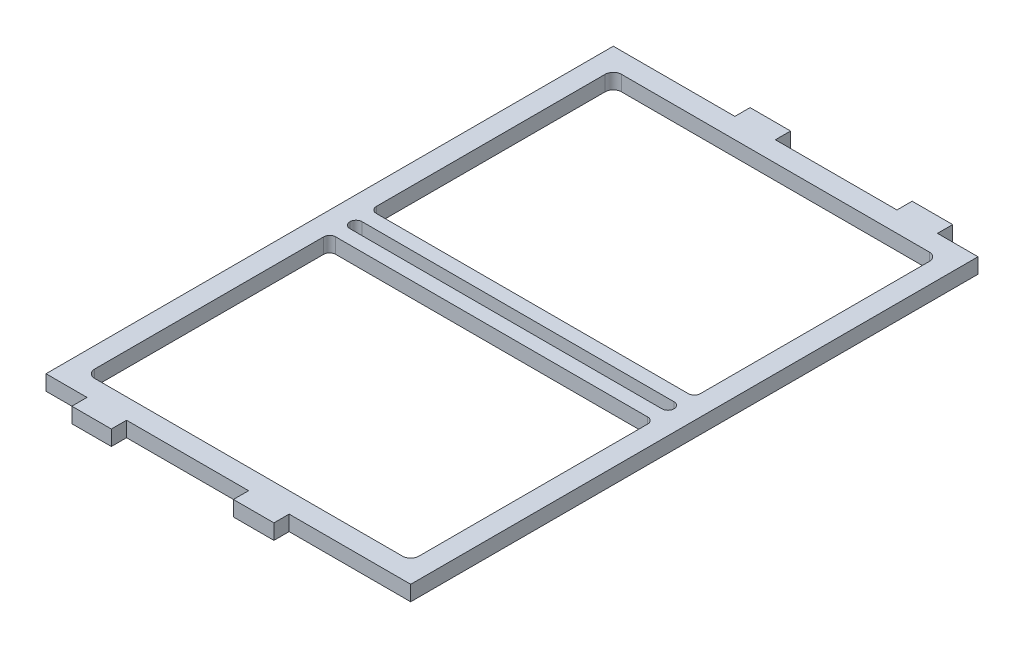
from build123d import *

# Parameters (mm, degrees)
SKETCH1_W           = 114.3
SKETCH1_H           = 177.8
SKETCH1_W_2         = 101.6
SKETCH1_H_2         = 165.1
BOSS_EXTRUDE1_DEPTH = 4.7625
SKETCH2_W           = 12.38677804
SKETCH2_H           = 4.7625
SKETCH2_W_2         = 12.7
BOSS_EXTRUDE2_DEPTH = 4.7625
SKETCH3_W           = 12.7
SKETCH3_H           = 4.7625
BOSS_EXTRUDE3_DEPTH = 4.7625
FILLET1_R           = 2.54
SKETCH5_W           = 114.3
SKETCH5_H           = 12.7
SKETCH5_W_2         = 101.6
SKETCH5_H_2         = 3.81
BOSS_EXTRUDE5_DEPTH = 4.7625
FILLET3_R           = 1.905


with BuildPart() as part:
    # Sketch1 → Boss-Extrude1 (new body)
    with BuildSketch(Plane(origin=(0, 0, 0), x_dir=(1, 0, 0), z_dir=(0, 1, 0))):
        Rectangle(SKETCH1_W, SKETCH1_H)
        Rectangle(SKETCH1_W_2, SKETCH1_H_2, mode=Mode.SUBTRACT)
    extrude(amount=BOSS_EXTRUDE1_DEPTH)

    # Sketch2 → Boss-Extrude2 (add)
    with BuildSketch(Plane.XY.offset(88.9)):
        with Locations((-38.1, 2.38125)):
            Rectangle(SKETCH2_W, SKETCH2_H)
        with Locations((12.7, 2.38125)):
            Rectangle(SKETCH2_W_2, SKETCH2_H)
    extrude(amount=BOSS_EXTRUDE2_DEPTH)

    # Sketch3 → Boss-Extrude3 (add)
    with BuildSketch(Plane(origin=(0, 0, -88.9), x_dir=(-1, 0, 0), z_dir=(0, 0, -1))):
        with Locations((-38.1, 2.38125)):
            Rectangle(SKETCH3_W, SKETCH3_H)
        with Locations((12.7, 2.38125)):
            Rectangle(SKETCH3_W, SKETCH3_H)
    extrude(amount=BOSS_EXTRUDE3_DEPTH)

    # Fillet1
    fillet1_edges = [part.edges().sort_by_distance(p)[0] for p in [
        (50.8, 2.38125, 82.55),
        (50.8, 2.38125, -82.55),
        (-50.8, 2.38125, -82.55),
        (-50.8, 2.38125, 82.55),
    ]]
    fillet(fillet1_edges, radius=FILLET1_R)

    # Sketch5 → Boss-Extrude5 (add)
    with BuildSketch(Plane.XZ):
        Rectangle(SKETCH5_W, SKETCH5_H)
        Rectangle(SKETCH5_W_2, SKETCH5_H_2, mode=Mode.SUBTRACT)
    extrude(amount=-BOSS_EXTRUDE5_DEPTH)

    # Fillet3
    fillet3_edges = [part.edges().sort_by_distance(p)[0] for p in [
        (-50.8, 2.38125, 6.35),
        (-50.8, 2.38125, -6.35),
        (50.8, 2.38125, -6.35),
        (50.8, 2.38125, 6.35),
        (50.8, 2.38125, -1.905),
        (-50.8, 2.38125, -1.905),
        (-50.8, 2.38125, 1.905),
        (50.8, 2.38125, 1.905),
    ]]
    fillet(fillet3_edges, radius=FILLET3_R - 0.0001)  # a hair under: the kernel refuses the full size


solid = part.part
